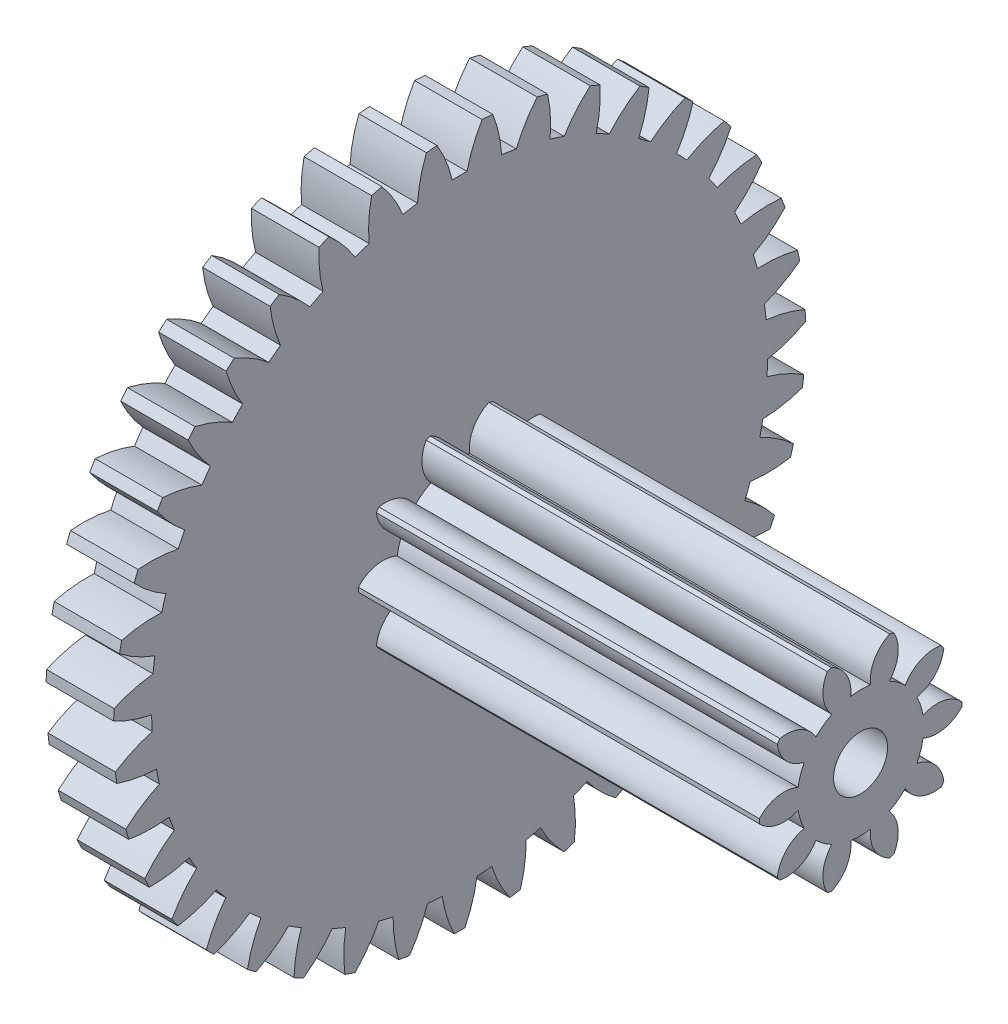
from build123d import *

# Parameters (mm, degrees)
ESQUISSE1_W                     = 1
ESQUISSE1_H                     = 5.125
ENL_V_MAT_EXTRU_1_DEPTH         = 8.316505313
ENL_V_MAT_EXTRU_2_DEPTH         = 8.316505313
ENL_V_MAT_EXTRU_3_DEPTH         = 8.316505313
ENL_V_MAT_EXTRU_4_DEPTH         = 8.316505313
ENL_V_MAT_EXTRU_5_DEPTH         = 8.316505313
ENL_V_MAT_EXTRU_6_DEPTH         = 8.316505313
ENL_V_MAT_EXTRU_7_DEPTH         = 8.316505313
ENL_V_MAT_EXTRU_8_DEPTH         = 8.316505313
ENL_V_MAT_EXTRU_9_DEPTH         = 8.316505313
ENL_V_MAT_EXTRU_10_DEPTH        = 8.316505313
ENL_V_MAT_EXTRU_11_DEPTH        = 8.316505313
ENL_V_MAT_EXTRU_12_DEPTH        = 8.316505313
ENL_V_MAT_EXTRU_13_DEPTH        = 8.316505313
ENL_V_MAT_EXTRU_14_DEPTH        = 8.316505313
ENL_V_MAT_EXTRU_15_DEPTH        = 8.316505313
ENL_V_MAT_EXTRU_16_DEPTH        = 8.316505313
ENL_V_MAT_EXTRU_17_DEPTH        = 8.316505313
ENL_V_MAT_EXTRU_18_DEPTH        = 8.316505313
ENL_V_MAT_EXTRU_19_DEPTH        = 8.316505313
ENL_V_MAT_EXTRU_20_DEPTH        = 8.316505313
ENL_V_MAT_EXTRU_21_DEPTH        = 8.316505313
ENL_V_MAT_EXTRU_22_DEPTH        = 8.316505313
ENL_V_MAT_EXTRU_23_DEPTH        = 8.316505313
ENL_V_MAT_EXTRU_24_DEPTH        = 8.316505313
ENL_V_MAT_EXTRU_25_DEPTH        = 8.316505313
ENL_V_MAT_EXTRU_26_DEPTH        = 8.316505313
ENL_V_MAT_EXTRU_27_DEPTH        = 8.316505313
ENL_V_MAT_EXTRU_28_DEPTH        = 8.316505313
ENL_V_MAT_EXTRU_29_DEPTH        = 8.316505313
ENL_V_MAT_EXTRU_30_DEPTH        = 8.316505313
ENL_V_MAT_EXTRU_31_DEPTH        = 8.316505313
ENL_V_MAT_EXTRU_32_DEPTH        = 8.315404959
ENL_V_MAT_EXTRU_33_DEPTH        = 8.315404959
ENL_V_MAT_EXTRU_34_DEPTH        = 8.315404959
ENL_V_MAT_EXTRU_35_DEPTH        = 8.315404959
ENL_V_MAT_EXTRU_36_DEPTH        = 8.315404959
ENL_V_MAT_EXTRU_37_DEPTH        = 8.315404959
ENL_V_MAT_EXTRU_38_DEPTH        = 8.315404959
ENL_V_MAT_EXTRU_39_DEPTH        = 8.315404959
BOSS_EXTRU_1_DEPTH              = 5.938524524
DIAM_TRE_DU_PER_AGE_0_8_0_8_1_D = 0.8


with BuildPart() as part:
    # Esquisse1 → Révolution1 (revolve)
    with BuildSketch(Plane(origin=(0, 0, 0), x_dir=(-1, 0, 0), z_dir=(0, 0, -1))):
        with Locations((-0.5, 2.5625)):
            Rectangle(ESQUISSE1_W, ESQUISSE1_H)
    revolve(axis=Axis((1, 0, 0), (-1, 0, 0)))

    # Esquisse2 → Enlèv. mat.-Extru.1 (cut, through all)
    with BuildSketch(Plane.ZY):
        with BuildLine():
            ThreePointArc((-0.491599352, 5.101367961), (-0.822107814, 5.058632596), (-1.149140058, 4.994507196))
            ThreePointArc((-1.149140058, 4.994507196), (-0.974871828, 4.75090918), (-0.839964848, 4.483496549))
            ThreePointArc((-0.839964848, 4.483496549), (-0.731716058, 4.502429773), (-0.623042589, 4.518749847))
            ThreePointArc((-0.623042589, 4.518749847), (-0.579759423, 4.815121196), (-0.491599352, 5.101367961))
        make_face()
    extrude(amount=-ENL_V_MAT_EXTRU_1_DEPTH, mode=Mode.SUBTRACT)

    # Esquisse3 → Enlèv. mat.-Extru.2 (cut, through all)
    with BuildSketch(Plane.ZY):
        with BuildLine():
            ThreePointArc((0.3330837, 5.114164668), (0, 5.125), (-0.3330837, 5.114164668))
            ThreePointArc((-0.3330837, 5.114164668), (-0.200148067, 4.845766593), (-0.1098841, 4.560176283))
            ThreePointArc((-0.1098841, 4.560176283), (0, 4.5615), (0.1098841, 4.560176283))
            ThreePointArc((0.1098841, 4.560176283), (0.200148067, 4.845766593), (0.3330837, 5.114164668))
        make_face()
    extrude(amount=-ENL_V_MAT_EXTRU_2_DEPTH, mode=Mode.SUBTRACT)

    # Esquisse4 → Enlèv. mat.-Extru.3 (cut, through all)
    with BuildSketch(Plane.ZY):
        with BuildLine():
            ThreePointArc((1.149140058, 4.994507196), (0.822107814, 5.058632596), (0.491599352, 5.101367961))
            ThreePointArc((0.491599352, 5.101367961), (0.579759423, 4.815121196), (0.623042589, 4.518749847))
            ThreePointArc((0.623042589, 4.518749847), (0.731716058, 4.502429773), (0.839964848, 4.483496549))
            ThreePointArc((0.839964848, 4.483496549), (0.974871828, 4.75090918), (1.149140058, 4.994507196))
        make_face()
    extrude(amount=-ENL_V_MAT_EXTRU_3_DEPTH, mode=Mode.SUBTRACT)

    # Esquisse5 → Enlèv. mat.-Extru.4 (cut, through all)
    with BuildSketch(Plane.ZY):
        with BuildLine():
            ThreePointArc((1.935434293, 4.745494611), (1.622923468, 4.861249265), (1.303550238, 4.956448504))
            ThreePointArc((1.303550238, 4.956448504), (1.34465145, 4.65976669), (1.339832802, 4.360290164))
            ThreePointArc((1.339832802, 4.360290164), (1.444481054, 4.32674898), (1.548290948, 4.290696609))
            ThreePointArc((1.548290948, 4.290696609), (1.724346921, 4.533005716), (1.935434293, 4.745494611))
        make_face()
    extrude(amount=-ENL_V_MAT_EXTRU_4_DEPTH, mode=Mode.SUBTRACT)

    # Esquisse6 → Enlèv. mat.-Extru.5 (cut, through all)
    with BuildSketch(Plane.ZY):
        with BuildLine():
            ThreePointArc((2.671601796, 4.373576208), (2.381706257, 4.537962131), (2.081739858, 4.683159635))
            ThreePointArc((2.081739858, 4.683159635), (2.07471771, 4.383726673), (2.021922049, 4.088901256))
            ThreePointArc((2.021922049, 4.088901256), (2.119834749, 4.039007661), (2.216517126, 3.986769881))
            ThreePointArc((2.216517126, 3.986769881), (2.429162334, 4.197699784), (2.671601796, 4.373576208))
        make_face()
    extrude(amount=-ENL_V_MAT_EXTRU_5_DEPTH, mode=Mode.SUBTRACT)

    # Esquisse7 → Enlèv. mat.-Extru.6 (cut, through all)
    with BuildSketch(Plane.ZY):
        with BuildLine():
            ThreePointArc((3.338576216, 3.888384478), (3.078804104, 4.097144162), (2.806013509, 4.28857939))
            ThreePointArc((2.806013509, 4.28857939), (2.751049871, 3.994150439), (2.651644577, 3.711611952))
            ThreePointArc((2.651644577, 3.711611952), (2.740285838, 3.646658165), (2.827336674, 3.579587907))
            ThreePointArc((2.827336674, 3.579587907), (3.071063719, 3.753675633), (3.338576216, 3.888384478))
        make_face()
    extrude(amount=-ENL_V_MAT_EXTRU_6_DEPTH, mode=Mode.SUBTRACT)

    # Esquisse8 → Enlèv. mat.-Extru.7 (cut, through all)
    with BuildSketch(Plane.ZY):
        with BuildLine():
            ThreePointArc((3.919083265, 3.302485634), (3.696162543, 3.550212312), (3.457612884, 3.782927193))
            ThreePointArc((3.457612884, 3.782927193), (3.356131286, 3.501127806), (3.212690904, 3.23819385))
            ThreePointArc((3.212690904, 3.23819385), (3.289764964, 3.159862139), (3.364929688, 3.079696486))
            ThreePointArc((3.364929688, 3.079696486), (3.633426167, 3.212433254), (3.919083265, 3.302485634))
        make_face()
    extrude(amount=-ENL_V_MAT_EXTRU_7_DEPTH, mode=Mode.SUBTRACT)

    # Esquisse9 → Enlèv. mat.-Extru.8 (cut, through all)
    with BuildSketch(Plane.ZY):
        with BuildLine():
            ThreePointArc((4.398088117, 2.631054146), (4.217792313, 2.911331827), (4.019661902, 3.179299168))
            ThreePointArc((4.019661902, 3.179299168), (3.874290663, 2.917427803), (3.690530223, 2.680908227))
            ThreePointArc((3.690530223, 2.680908227), (3.754040904, 2.591227342), (3.81537279, 2.500042544))
            ThreePointArc((3.81537279, 2.500042544), (4.101684785, 2.587990542), (4.398088117, 2.631054146))
        make_face()
    extrude(amount=-ENL_V_MAT_EXTRU_8_DEPTH, mode=Mode.SUBTRACT)

    # Esquisse10 → Enlèv. mat.-Extru.9 (cut, through all)
    with BuildSketch(Plane.ZY):
        with BuildLine():
            ThreePointArc((4.763184796, 1.891479738), (4.630183477, 2.197049377), (4.477603787, 2.493328964))
            ThreePointArc((4.477603787, 2.493328964), (4.292107947, 2.258167951), (4.072786749, 2.054188489))
            ThreePointArc((4.072786749, 2.054188489), (4.121089157, 1.955481119), (4.166999741, 1.855638814))
            ThreePointArc((4.166999741, 1.855638814), (4.463711922, 1.896520234), (4.763184796, 1.891479738))
        make_face()
    extrude(amount=-ENL_V_MAT_EXTRU_9_DEPTH, mode=Mode.SUBTRACT)

    # Esquisse11 → Enlèv. mat.-Extru.10 (cut, through all)
    with BuildSketch(Plane.ZY):
        with BuildLine():
            ThreePointArc((5.004917491, 1.102916998), (4.922655322, 1.425864503), (4.819578087, 1.74278285))
            ThreePointArc((4.819578087, 1.74278285), (4.59876189, 1.540422736), (4.349560237, 1.374266349))
            ThreePointArc((4.349560237, 1.374266349), (4.381403366, 1.269088962), (4.410703588, 1.163175012))
            ThreePointArc((4.410703588, 1.163175012), (4.710131265, 1.155931048), (5.004917491, 1.102916998))
        make_face()
    extrude(amount=-ENL_V_MAT_EXTRU_10_DEPTH, mode=Mode.SUBTRACT)

    # Esquisse12 → Enlèv. mat.-Extru.11 (cut, through all)
    with BuildSketch(Plane.ZY):
        with BuildLine():
            ThreePointArc((5.117025453, 0.285789287), (5.08763298, 0.617750486), (5.036727846, 0.947099576))
            ThreePointArc((5.036727846, 0.947099576), (4.786310315, 0.782781381), (4.513682399, 0.658751432))
            ThreePointArc((4.513682399, 0.658751432), (4.528241529, 0.549828067), (4.540172528, 0.440585589))
            ThreePointArc((4.540172528, 0.440585589), (4.834560682, 0.385403856), (5.117025453, 0.285789287))
        make_face()
    extrude(amount=-ENL_V_MAT_EXTRU_11_DEPTH, mode=Mode.SUBTRACT)

    # Esquisse13 → Enlèv. mat.-Extru.12 (cut, through all)
    with BuildSketch(Plane.ZY):
        with BuildLine():
            ThreePointArc((5.096605143, -0.538740217), (5.120843616, -0.206362943), (5.123428999, 0.12688692))
            ThreePointArc((5.123428999, 0.12688692), (4.849895818, 0.0048664), (4.560902559, -0.073824801))
            ThreePointArc((4.560902559, -0.073824801), (4.557800615, -0.183673086), (4.552053385, -0.293414769))
            ThreePointArc((4.552053385, -0.293414769), (4.833777517, -0.395105094), (5.096605143, -0.538740217))
        make_face()
    extrude(amount=-ENL_V_MAT_EXTRU_12_DEPTH, mode=Mode.SUBTRACT)

    # Esquisse14 → Enlèv. mat.-Extru.13 (cut, through all)
    with BuildSketch(Plane.ZY):
        with BuildLine():
            ThreePointArc((4.944185436, -1.349316631), (5.021427092, -1.025131681), (5.077436033, -0.69661204))
            ThreePointArc((5.077436033, -0.69661204), (4.787871566, -0.773174619), (4.489997737, -0.804489011))
            ThreePointArc((4.489997737, -0.804489011), (4.469315059, -0.912417202), (4.446038451, -1.019815839))
            ThreePointArc((4.446038451, -1.019815839), (4.707802054, -1.16538103), (4.944185436, -1.349316631))
        make_face()
    extrude(amount=-ENL_V_MAT_EXTRU_13_DEPTH, mode=Mode.SUBTRACT)

    # Esquisse15 → Enlèv. mat.-Extru.14 (cut, through all)
    with BuildSketch(Plane.ZY):
        with BuildLine():
            ThreePointArc((4.663713924, -2.124946454), (4.791958244, -1.817350046), (4.89994014, -1.502069115))
            ThreePointArc((4.89994014, -1.502069115), (4.601843956, -1.531190821), (4.302804333, -1.514317378))
            ThreePointArc((4.302804333, -1.514317378), (4.265076591, -1.617530192), (4.224873456, -1.719804214))
            ThreePointArc((4.224873456, -1.719804214), (4.45989699, -1.905474209), (4.663713924, -2.124946454))
        make_face()
    extrude(amount=-ENL_V_MAT_EXTRU_14_DEPTH, mode=Mode.SUBTRACT)

    # Esquisse16 → Enlèv. mat.-Extru.15 (cut, through all)
    with BuildSketch(Plane.ZY):
        with BuildLine():
            ThreePointArc((4.262454672, -2.845541279), (4.438380194, -2.5625), (4.595538371, -2.268623388))
            ThreePointArc((4.595538371, -2.268623388), (4.296631004, -2.249549986), (4.004170557, -2.18492572))
            ThreePointArc((4.004170557, -2.18492572), (3.950374879, -2.28075), (3.894286457, -2.375250564))
            ThreePointArc((3.894286457, -2.375250564), (4.096482937, -2.596216607), (4.262454672, -2.845541279))
        make_face()
    extrude(amount=-ENL_V_MAT_EXTRU_15_DEPTH, mode=Mode.SUBTRACT)

    # Esquisse17 → Enlèv. mat.-Extru.16 (cut, through all)
    with BuildSketch(Plane.ZY):
        with BuildLine():
            ThreePointArc((3.750800082, -3.492438081), (3.969850429, -3.24128255), (4.172114573, -2.976421508))
            ThreePointArc((4.172114573, -2.976421508), (3.880137567, -2.909646987), (3.601830867, -2.798945633))
            ThreePointArc((3.601830867, -2.798945633), (3.533360533, -2.884899581), (3.462839485, -2.969179171))
            ThreePointArc((3.462839485, -2.969179171), (3.626972127, -3.219718359), (3.750800082, -3.492438081))
        make_face()
    extrude(amount=-ENL_V_MAT_EXTRU_16_DEPTH, mode=Mode.SUBTRACT)

    # Esquisse18 → Enlèv. mat.-Extru.17 (cut, through all)
    with BuildSketch(Plane.ZY):
        with BuildLine():
            ThreePointArc((3.14200174, -4.04888257), (3.398503623, -3.836117584), (3.640635198, -3.607131873))
            ThreePointArc((3.640635198, -3.607131873), (3.363150604, -3.49438566), (3.106205649, -3.340474325))
            ThreePointArc((3.106205649, -3.340474325), (3.024834006, -3.414331778), (2.941706789, -3.486207598))
            ThreePointArc((2.941706789, -3.486207598), (3.063524645, -3.759831097), (3.14200174, -4.04888257))
        make_face()
    extrude(amount=-ENL_V_MAT_EXTRU_17_DEPTH, mode=Mode.SUBTRACT)

    # Esquisse19 → Enlèv. mat.-Extru.18 (cut, through all)
    with BuildSketch(Plane.ZY):
        with BuildLine():
            ThreePointArc((2.451827203, -4.500463128), (2.739137359, -4.331599188), (3.014865285, -4.144419418))
            ThreePointArc((3.014865285, -4.144419418), (2.759059808, -3.988621579), (2.530131336, -3.795486487))
            ThreePointArc((2.530131336, -3.795486487), (2.437965866, -3.855334575), (2.344385433, -3.912945079))
            ThreePointArc((2.344385433, -3.912945079), (2.420733483, -4.202566184), (2.451827203, -4.500463128))
        make_face()
    extrude(amount=-ENL_V_MAT_EXTRU_18_DEPTH, mode=Mode.SUBTRACT)

    # Esquisse20 → Enlèv. mat.-Extru.19 (cut, through all)
    with BuildSketch(Plane.ZY):
        with BuildLine():
            ThreePointArc((1.69815163, -4.835484054), (2.008828876, -4.714894649), (2.311011944, -4.574368677))
            ThreePointArc((2.311011944, -4.574368677), (2.083510811, -4.379554295), (1.888527951, -4.152197542))
            ThreePointArc((1.888527951, -4.152197542), (1.787955691, -4.196486232), (1.686345725, -4.238339338))
            ThreePointArc((1.686345725, -4.238339338), (1.715246596, -4.536457014), (1.69815163, -4.835484054))
        make_face()
    extrude(amount=-ENL_V_MAT_EXTRU_19_DEPTH, mode=Mode.SUBTRACT)

    # Esquisse21 → Enlèv. mat.-Extru.20 (cut, through all)
    with BuildSketch(Plane.ZY):
        with BuildLine():
            ThreePointArc((0.900494822, -5.045268484), (1.226492779, -4.976076814), (1.547304608, -4.88584419))
            ThreePointArc((1.547304608, -4.88584419), (1.35399998, -4.657058855), (1.198012684, -4.401368862))
            ThreePointArc((1.198012684, -4.401368862), (1.091638403, -4.4289511), (0.984630549, -4.453962835))
            ThreePointArc((0.984630549, -4.453962835), (0.965335723, -4.75285599), (0.900494822, -5.045268484))
        make_face()
    extrude(amount=-ENL_V_MAT_EXTRU_20_DEPTH, mode=Mode.SUBTRACT)

    # Esquisse22 → Enlèv. mat.-Extru.21 (cut, through all)
    with BuildSketch(Plane.ZY):
        with BuildLine():
            ThreePointArc((0.079515671, -5.12438311), (0.412391165, -5.108381204), (0.743522895, -5.070778905))
            ThreePointArc((0.743522895, -5.070778905), (0.589421259, -4.813948037), (0.476469518, -4.53654704))
            ThreePointArc((0.476469518, -4.53654704), (0.367048253, -4.546708461), (0.257413959, -4.554231033))
            ThreePointArc((0.257413959, -4.554231033), (0.190423162, -4.846158493), (0.079515671, -5.12438311))
        make_face()
    extrude(amount=-ENL_V_MAT_EXTRU_21_DEPTH, mode=Mode.SUBTRACT)

    # Esquisse23 → Enlèv. mat.-Extru.22 (cut, through all)
    with BuildSketch(Plane.ZY):
        with BuildLine():
            ThreePointArc((-0.743522895, -5.070778905), (-0.412391165, -5.108381204), (-0.079515671, -5.12438311))
            ThreePointArc((-0.079515671, -5.12438311), (-0.190423162, -4.846158493), (-0.257413959, -4.554231033))
            ThreePointArc((-0.257413959, -4.554231033), (-0.367048253, -4.546708461), (-0.476469518, -4.53654704))
            ThreePointArc((-0.476469518, -4.53654704), (-0.589421259, -4.813948037), (-0.743522895, -5.070778905))
        make_face()
    extrude(amount=-ENL_V_MAT_EXTRU_22_DEPTH, mode=Mode.SUBTRACT)

    # Esquisse24 → Enlèv. mat.-Extru.23 (cut, through all)
    with BuildSketch(Plane.ZY):
        with BuildLine():
            ThreePointArc((-1.547304608, -4.88584419), (-1.226492779, -4.976076814), (-0.900494822, -5.045268484))
            ThreePointArc((-0.900494822, -5.045268484), (-0.965335723, -4.75285599), (-0.984630549, -4.453962835))
            ThreePointArc((-0.984630549, -4.453962835), (-1.091638403, -4.4289511), (-1.198012684, -4.401368862))
            ThreePointArc((-1.198012684, -4.401368862), (-1.35399998, -4.657058855), (-1.547304608, -4.88584419))
        make_face()
    extrude(amount=-ENL_V_MAT_EXTRU_23_DEPTH, mode=Mode.SUBTRACT)

    # Esquisse25 → Enlèv. mat.-Extru.24 (cut, through all)
    with BuildSketch(Plane.ZY):
        with BuildLine():
            ThreePointArc((-2.311011944, -4.574368677), (-2.008828876, -4.714894649), (-1.69815163, -4.835484054))
            ThreePointArc((-1.69815163, -4.835484054), (-1.715246596, -4.536457014), (-1.686345725, -4.238339338))
            ThreePointArc((-1.686345725, -4.238339338), (-1.787955691, -4.196486232), (-1.888527951, -4.152197542))
            ThreePointArc((-1.888527951, -4.152197542), (-2.083510811, -4.379554295), (-2.311011944, -4.574368677))
        make_face()
    extrude(amount=-ENL_V_MAT_EXTRU_24_DEPTH, mode=Mode.SUBTRACT)

    # Esquisse26 → Enlèv. mat.-Extru.25 (cut, through all)
    with BuildSketch(Plane.ZY):
        with BuildLine():
            ThreePointArc((-3.014865285, -4.144419418), (-2.739137359, -4.331599188), (-2.451827203, -4.500463128))
            ThreePointArc((-2.451827203, -4.500463128), (-2.420733483, -4.202566184), (-2.344385433, -3.912945079))
            ThreePointArc((-2.344385433, -3.912945079), (-2.437965866, -3.855334575), (-2.530131336, -3.795486487))
            ThreePointArc((-2.530131336, -3.795486487), (-2.759059808, -3.988621579), (-3.014865285, -4.144419418))
        make_face()
    extrude(amount=-ENL_V_MAT_EXTRU_25_DEPTH, mode=Mode.SUBTRACT)

    # Esquisse27 → Enlèv. mat.-Extru.26 (cut, through all)
    with BuildSketch(Plane.ZY):
        with BuildLine():
            ThreePointArc((-3.640635198, -3.607131873), (-3.398503623, -3.836117584), (-3.14200174, -4.04888257))
            ThreePointArc((-3.14200174, -4.04888257), (-3.063524645, -3.759831097), (-2.941706789, -3.486207598))
            ThreePointArc((-2.941706789, -3.486207598), (-3.024834006, -3.414331778), (-3.106205649, -3.340474325))
            ThreePointArc((-3.106205649, -3.340474325), (-3.363150604, -3.49438566), (-3.640635198, -3.607131873))
        make_face()
    extrude(amount=-ENL_V_MAT_EXTRU_26_DEPTH, mode=Mode.SUBTRACT)

    # Esquisse28 → Enlèv. mat.-Extru.27 (cut, through all)
    with BuildSketch(Plane.ZY):
        with BuildLine():
            ThreePointArc((-4.172114573, -2.976421508), (-3.969850429, -3.24128255), (-3.750800082, -3.492438081))
            ThreePointArc((-3.750800082, -3.492438081), (-3.626972127, -3.219718359), (-3.462839485, -2.969179171))
            ThreePointArc((-3.462839485, -2.969179171), (-3.533360533, -2.884899581), (-3.601830867, -2.798945633))
            ThreePointArc((-3.601830867, -2.798945633), (-3.880137567, -2.909646987), (-4.172114573, -2.976421508))
        make_face()
    extrude(amount=-ENL_V_MAT_EXTRU_27_DEPTH, mode=Mode.SUBTRACT)

    # Esquisse29 → Enlèv. mat.-Extru.28 (cut, through all)
    with BuildSketch(Plane.ZY):
        with BuildLine():
            ThreePointArc((-4.595538371, -2.268623388), (-4.438380194, -2.5625), (-4.262454672, -2.845541279))
            ThreePointArc((-4.262454672, -2.845541279), (-4.096482937, -2.596216607), (-3.894286457, -2.375250564))
            ThreePointArc((-3.894286457, -2.375250564), (-3.950374879, -2.28075), (-4.004170557, -2.18492572))
            ThreePointArc((-4.004170557, -2.18492572), (-4.296631004, -2.249549986), (-4.595538371, -2.268623388))
        make_face()
    extrude(amount=-ENL_V_MAT_EXTRU_28_DEPTH, mode=Mode.SUBTRACT)

    # Esquisse30 → Enlèv. mat.-Extru.29 (cut, through all)
    with BuildSketch(Plane.ZY):
        with BuildLine():
            ThreePointArc((-4.89994014, -1.502069115), (-4.791958244, -1.817350046), (-4.663713924, -2.124946454))
            ThreePointArc((-4.663713924, -2.124946454), (-4.45989699, -1.905474209), (-4.224873456, -1.719804214))
            ThreePointArc((-4.224873456, -1.719804214), (-4.265076591, -1.617530192), (-4.302804333, -1.514317378))
            ThreePointArc((-4.302804333, -1.514317378), (-4.601843956, -1.531190821), (-4.89994014, -1.502069115))
        make_face()
    extrude(amount=-ENL_V_MAT_EXTRU_29_DEPTH, mode=Mode.SUBTRACT)

    # Esquisse31 → Enlèv. mat.-Extru.30 (cut, through all)
    with BuildSketch(Plane.ZY):
        with BuildLine():
            ThreePointArc((-5.077436033, -0.69661204), (-5.021427092, -1.025131681), (-4.944185436, -1.349316631))
            ThreePointArc((-4.944185436, -1.349316631), (-4.707802054, -1.16538103), (-4.446038451, -1.019815839))
            ThreePointArc((-4.446038451, -1.019815839), (-4.469315059, -0.912417202), (-4.489997737, -0.804489011))
            ThreePointArc((-4.489997737, -0.804489011), (-4.787871566, -0.773174619), (-5.077436033, -0.69661204))
        make_face()
    extrude(amount=-ENL_V_MAT_EXTRU_30_DEPTH, mode=Mode.SUBTRACT)

    # Esquisse32 → Enlèv. mat.-Extru.31 (cut, through all)
    with BuildSketch(Plane.ZY):
        with BuildLine():
            ThreePointArc((-5.123428999, 0.12688692), (-5.120843616, -0.206362943), (-5.096605143, -0.538740217))
            ThreePointArc((-5.096605143, -0.538740217), (-4.833777517, -0.395105094), (-4.552053385, -0.293414769))
            ThreePointArc((-4.552053385, -0.293414769), (-4.557800615, -0.183673086), (-4.560902559, -0.073824801))
            ThreePointArc((-4.560902559, -0.073824801), (-4.849895818, 0.0048664), (-5.123428999, 0.12688692))
        make_face()
    extrude(amount=-ENL_V_MAT_EXTRU_31_DEPTH, mode=Mode.SUBTRACT)

    # Esquisse33 → Enlèv. mat.-Extru.32 (cut, through all)
    with BuildSketch(Plane.ZY):
        with BuildLine():
            ThreePointArc((-5.036727846, 0.947099576), (-5.08763298, 0.617750486), (-5.117025453, 0.285789287))
            ThreePointArc((-5.117025453, 0.285789287), (-4.834560682, 0.385403856), (-4.540172528, 0.440585589))
            ThreePointArc((-4.540172528, 0.440585589), (-4.528241529, 0.549828067), (-4.513682399, 0.658751432))
            ThreePointArc((-4.513682399, 0.658751432), (-4.786310315, 0.782781381), (-5.036727846, 0.947099576))
        make_face()
    extrude(amount=-ENL_V_MAT_EXTRU_32_DEPTH, mode=Mode.SUBTRACT)

    # Esquisse34 → Enlèv. mat.-Extru.33 (cut, through all)
    with BuildSketch(Plane.ZY):
        with BuildLine():
            ThreePointArc((-4.819578087, 1.74278285), (-4.922655322, 1.425864503), (-5.004917491, 1.102916998))
            ThreePointArc((-5.004917491, 1.102916998), (-4.710131265, 1.155931048), (-4.410703588, 1.163175012))
            ThreePointArc((-4.410703588, 1.163175012), (-4.381403366, 1.269088962), (-4.349560237, 1.374266349))
            ThreePointArc((-4.349560237, 1.374266349), (-4.59876189, 1.540422736), (-4.819578087, 1.74278285))
        make_face()
    extrude(amount=-ENL_V_MAT_EXTRU_33_DEPTH, mode=Mode.SUBTRACT)

    # Esquisse35 → Enlèv. mat.-Extru.34 (cut, through all)
    with BuildSketch(Plane.ZY):
        with BuildLine():
            ThreePointArc((-4.477603787, 2.493328964), (-4.630183477, 2.197049377), (-4.763184796, 1.891479738))
            ThreePointArc((-4.763184796, 1.891479738), (-4.463711922, 1.896520234), (-4.166999741, 1.855638814))
            ThreePointArc((-4.166999741, 1.855638814), (-4.121089157, 1.955481119), (-4.072786749, 2.054188489))
            ThreePointArc((-4.072786749, 2.054188489), (-4.292107947, 2.258167951), (-4.477603787, 2.493328964))
        make_face()
    extrude(amount=-ENL_V_MAT_EXTRU_34_DEPTH, mode=Mode.SUBTRACT)

    # Esquisse36 → Enlèv. mat.-Extru.35 (cut, through all)
    with BuildSketch(Plane.ZY):
        with BuildLine():
            ThreePointArc((-4.019661902, 3.179299168), (-4.217792313, 2.911331827), (-4.398088117, 2.631054146))
            ThreePointArc((-4.398088117, 2.631054146), (-4.101684785, 2.587990542), (-3.81537279, 2.500042544))
            ThreePointArc((-3.81537279, 2.500042544), (-3.754040904, 2.591227342), (-3.690530223, 2.680908227))
            ThreePointArc((-3.690530223, 2.680908227), (-3.874290663, 2.917427803), (-4.019661902, 3.179299168))
        make_face()
    extrude(amount=-ENL_V_MAT_EXTRU_35_DEPTH, mode=Mode.SUBTRACT)

    # Esquisse37 → Enlèv. mat.-Extru.36 (cut, through all)
    with BuildSketch(Plane.ZY):
        with BuildLine():
            ThreePointArc((-3.457612884, 3.782927193), (-3.696162543, 3.550212312), (-3.919083265, 3.302485634))
            ThreePointArc((-3.919083265, 3.302485634), (-3.633426167, 3.212433254), (-3.364929688, 3.079696486))
            ThreePointArc((-3.364929688, 3.079696486), (-3.289764964, 3.159862139), (-3.212690904, 3.23819385))
            ThreePointArc((-3.212690904, 3.23819385), (-3.356131286, 3.501127806), (-3.457612884, 3.782927193))
        make_face()
    extrude(amount=-ENL_V_MAT_EXTRU_36_DEPTH, mode=Mode.SUBTRACT)

    # Esquisse38 → Enlèv. mat.-Extru.37 (cut, through all)
    with BuildSketch(Plane.ZY):
        with BuildLine():
            ThreePointArc((-2.806013509, 4.28857939), (-3.078804104, 4.097144162), (-3.338576216, 3.888384478))
            ThreePointArc((-3.338576216, 3.888384478), (-3.071063719, 3.753675633), (-2.827336674, 3.579587907))
            ThreePointArc((-2.827336674, 3.579587907), (-2.740285838, 3.646658165), (-2.651644577, 3.711611952))
            ThreePointArc((-2.651644577, 3.711611952), (-2.751049871, 3.994150439), (-2.806013509, 4.28857939))
        make_face()
    extrude(amount=-ENL_V_MAT_EXTRU_37_DEPTH, mode=Mode.SUBTRACT)

    # Esquisse39 → Enlèv. mat.-Extru.38 (cut, through all)
    with BuildSketch(Plane.ZY):
        with BuildLine():
            ThreePointArc((-2.081739858, 4.683159635), (-2.381706257, 4.537962131), (-2.671601796, 4.373576208))
            ThreePointArc((-2.671601796, 4.373576208), (-2.429162334, 4.197699784), (-2.216517126, 3.986769881))
            ThreePointArc((-2.216517126, 3.986769881), (-2.119834749, 4.039007661), (-2.021922049, 4.088901256))
            ThreePointArc((-2.021922049, 4.088901256), (-2.07471771, 4.383726673), (-2.081739858, 4.683159635))
        make_face()
    extrude(amount=-ENL_V_MAT_EXTRU_38_DEPTH, mode=Mode.SUBTRACT)

    # Esquisse40 → Enlèv. mat.-Extru.39 (cut, through all)
    with BuildSketch(Plane.ZY):
        with BuildLine():
            ThreePointArc((-1.303550238, 4.956448504), (-1.622923468, 4.861249265), (-1.935434293, 4.745494611))
            ThreePointArc((-1.935434293, 4.745494611), (-1.724346921, 4.533005716), (-1.548290948, 4.290696609))
            ThreePointArc((-1.548290948, 4.290696609), (-1.444481054, 4.32674898), (-1.339832802, 4.360290164))
            ThreePointArc((-1.339832802, 4.360290164), (-1.34465145, 4.65976669), (-1.303550238, 4.956448504))
        make_face()
    extrude(amount=-ENL_V_MAT_EXTRU_39_DEPTH, mode=Mode.SUBTRACT)

    # Esquisse41 → Boss.-Extru.1 (add)
    with BuildSketch(Plane(origin=(1, 0, 0), x_dir=(0, 0, -1), z_dir=(1, 0, 0))):
        with BuildLine():
            ThreePointArc((0.662076845, 0.662334131), (0.888221597, 0.871258232), (1.193891961, 0.908086992))
            ThreePointArc((1.193891961, 0.908086992), (1.213525492, 0.881677878), (1.232574957, 0.854844416))
            ThreePointArc((1.232574957, 0.854844416), (1.103091387, 0.575515338), (0.834510188, 0.424999995))
            ThreePointArc((0.834510188, 0.424999995), (0.890664428, 0.289394415), (0.924941654, 0.146680563))
            ThreePointArc((0.924941654, 0.146680563), (1.230699107, 0.18277916), (1.499639028, 0.032905721))
            ThreePointArc((1.499639028, 0.032905721), (1.5, 0), (1.499639028, -0.032905721))
            ThreePointArc((1.499639028, -0.032905721), (1.230699107, -0.18277916), (0.924941654, -0.146680563))
            ThreePointArc((0.924941654, -0.146680563), (0.890664428, -0.289394415), (0.834510188, -0.424999995))
            ThreePointArc((0.834510188, -0.424999995), (1.103091387, -0.575515338), (1.232574957, -0.854844416))
            ThreePointArc((1.232574957, -0.854844416), (1.213525492, -0.881677878), (1.193891961, -0.908086992))
            ThreePointArc((1.193891961, -0.908086992), (0.888221597, -0.871258232), (0.662076845, -0.662334131))
            ThreePointArc((0.662076845, -0.662334131), (0.550460889, -0.757644415), (0.425324195, -0.834345))
            ThreePointArc((0.425324195, -0.834345), (0.55414025, -1.113982538), (0.494709146, -1.416073042))
            ThreePointArc((0.494709146, -1.416073042), (0.463525492, -1.426584774), (0.432118744, -1.436409897))
            ThreePointArc((0.432118744, -1.436409897), (0.206473627, -1.226946272), (0.146321185, -0.924998573))
            ThreePointArc((0.146321185, -0.924998573), (0, -0.9365), (-0.146321185, -0.924998573))
            ThreePointArc((-0.146321185, -0.924998573), (-0.206473627, -1.226946272), (-0.432118744, -1.436409897))
            ThreePointArc((-0.432118744, -1.436409897), (-0.463525492, -1.426584774), (-0.494709146, -1.416073042))
            ThreePointArc((-0.494709146, -1.416073042), (-0.55414025, -1.113982538), (-0.425324195, -0.834345))
            ThreePointArc((-0.425324195, -0.834345), (-0.550460889, -0.757644415), (-0.662076845, -0.662334131))
            ThreePointArc((-0.662076845, -0.662334131), (-0.888221597, -0.871258232), (-1.193891961, -0.908086992))
            ThreePointArc((-1.193891961, -0.908086992), (-1.213525492, -0.881677878), (-1.232574957, -0.854844416))
            ThreePointArc((-1.232574957, -0.854844416), (-1.103091387, -0.575515338), (-0.834510188, -0.424999995))
            ThreePointArc((-0.834510188, -0.424999995), (-0.890664428, -0.289394415), (-0.924941654, -0.146680563))
            ThreePointArc((-0.924941654, -0.146680563), (-1.230699107, -0.18277916), (-1.499639028, -0.032905721))
            ThreePointArc((-1.499639028, -0.032905721), (-1.5, 0), (-1.499639028, 0.032905721))
            ThreePointArc((-1.499639028, 0.032905721), (-1.230699107, 0.18277916), (-0.924941654, 0.146680563))
            ThreePointArc((-0.924941654, 0.146680563), (-0.890664428, 0.289394415), (-0.834510188, 0.424999995))
            ThreePointArc((-0.834510188, 0.424999995), (-1.103091387, 0.575515338), (-1.232574957, 0.854844416))
            ThreePointArc((-1.232574957, 0.854844416), (-1.213525492, 0.881677878), (-1.193891961, 0.908086992))
            ThreePointArc((-1.193891961, 0.908086992), (-0.888221597, 0.871258232), (-0.662076845, 0.662334131))
            ThreePointArc((-0.662076845, 0.662334131), (-0.550460889, 0.757644415), (-0.425324195, 0.834345))
            ThreePointArc((-0.425324195, 0.834345), (-0.55414025, 1.113982538), (-0.494709146, 1.416073042))
            ThreePointArc((-0.494709146, 1.416073042), (-0.463525492, 1.426584774), (-0.432118744, 1.436409897))
            ThreePointArc((-0.432118744, 1.436409897), (-0.206473627, 1.226946272), (-0.146321185, 0.924998573))
            ThreePointArc((-0.146321185, 0.924998573), (0, 0.9365), (0.146321185, 0.924998573))
            ThreePointArc((0.146321185, 0.924998573), (0.206473627, 1.226946272), (0.432118744, 1.436409897))
            ThreePointArc((0.432118744, 1.436409897), (0.463525492, 1.426584774), (0.494709146, 1.416073042))
            ThreePointArc((0.494709146, 1.416073042), (0.55414025, 1.113982538), (0.425324195, 0.834345))
            ThreePointArc((0.425324195, 0.834345), (0.550460889, 0.757644415), (0.662076845, 0.662334131))
        make_face()
    extrude(amount=BOSS_EXTRU_1_DEPTH)

    # Diamètre du perçage Ø0.8 (0.8)1 (through all)
    with Locations(Plane.ZY):
        with Locations((0, 0)):
            Hole(DIAM_TRE_DU_PER_AGE_0_8_0_8_1_D / 2)


solid = part.part
